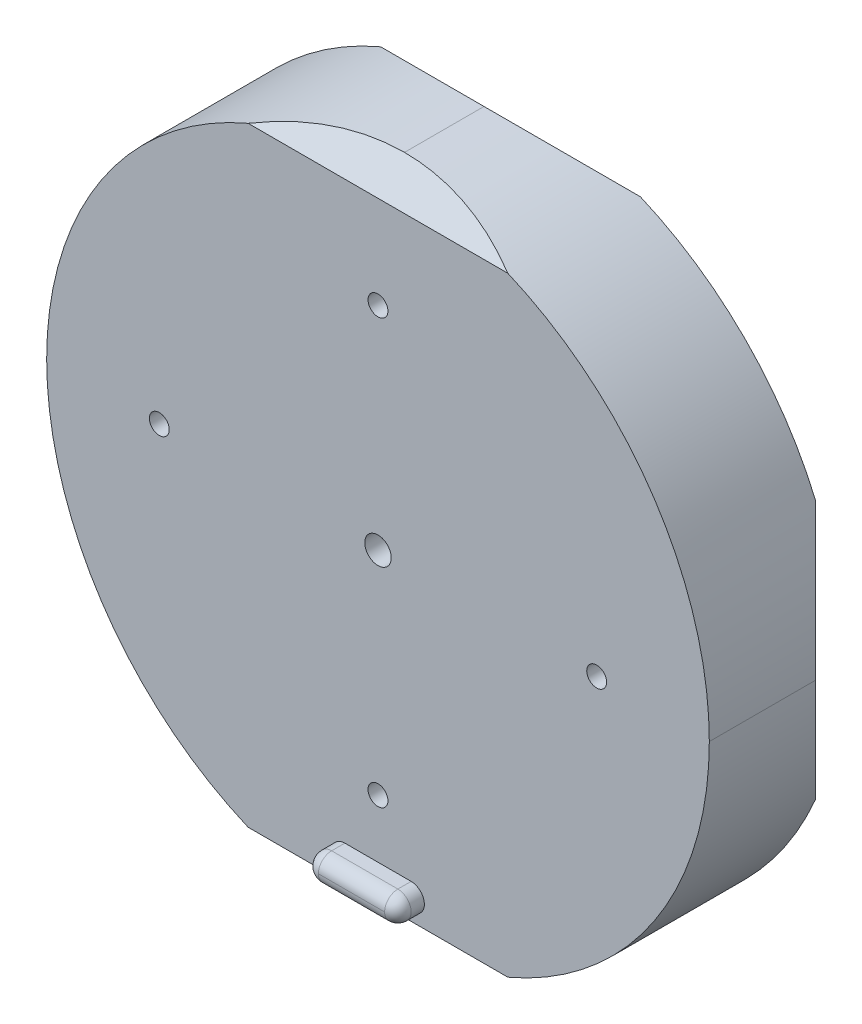
from build123d import *

# Parameters (mm, degrees)
SKETCH10_W          = 50
SKETCH10_H          = 50
BOSS_EXTRUDE7_DEPTH = 5
SKETCH9_W           = 50
SKETCH9_H           = 50
BOSS_EXTRUDE8_DEPTH = 5
SKETCH11_R          = 0.75
CUT_EXTRUDE5_DEPTH  = 5
CHAMFER1_SIZE       = 2
SKETCH12_R          = 1
CUT_EXTRUDE6_DEPTH  = 10
SKETCH14_R          = 0.75
CUT_EXTRUDE8_DEPTH  = 5
BOSS_EXTRUDE9_DEPTH = 2
FILLET1_R           = 1
FILLET2_R           = 25


# Some blends are built 0.0001 mm under size
with BuildPart() as part:
    # Sketch10 → Boss-Extrude7 (new body)
    with BuildSketch(Plane(origin=(0, 0, 0), x_dir=(-1, 0, 0), z_dir=(0, 0, -1))):
        with Locations((-42.5, 20.5)):
            Rectangle(SKETCH10_W, SKETCH10_H)
    extrude(amount=-BOSS_EXTRUDE7_DEPTH)

    # Sketch9 → Boss-Extrude8 (add)
    with BuildSketch(Plane(origin=(0, 0, 0), x_dir=(-1, 0, 0), z_dir=(0, 0, -1))):
        with Locations((-42.5, 20.5)):
            Rectangle(SKETCH9_W, SKETCH9_H)
        with BuildLine():
            Line((-59.2, 24.3), (-48.011787453, 24.5))
            ThreePointArc((-48.011787453, 24.5), (-46.919880362, 24.919880362), (-46.5, 26.011787453))
            Line((-46.5, 26.011787453), (-46.3, 37.2))
            ThreePointArc((-46.3, 37.2), (-42.5, 41), (-38.7, 37.2))
            Line((-38.7, 37.2), (-38.5, 26.011787453))
            ThreePointArc((-38.5, 26.011787453), (-38.080119638, 24.919880362), (-36.988212547, 24.5))
            Line((-36.988212547, 24.5), (-25.8, 24.3))
            ThreePointArc((-25.8, 24.3), (-22, 20.5), (-25.8, 16.7))
            Line((-25.8, 16.7), (-36.988212547, 16.5))
            ThreePointArc((-36.988212547, 16.5), (-38.080119638, 16.080119638), (-38.5, 14.988212547))
            Line((-38.5, 14.988212547), (-38.7, 3.8))
            ThreePointArc((-38.7, 3.8), (-42.5, 0), (-46.3, 3.8))
            Line((-46.3, 3.8), (-46.5, 14.988212547))
            ThreePointArc((-46.5, 14.988212547), (-46.919880362, 16.080119638), (-48.011787453, 16.5))
            Line((-48.011787453, 16.5), (-59.2, 16.7))
            ThreePointArc((-59.2, 16.7), (-63, 20.5), (-59.2, 24.3))
        make_face(mode=Mode.SUBTRACT)
    extrude(amount=BOSS_EXTRUDE8_DEPTH)

    # Sketch11 → Cut-Extrude5 (cut)
    with BuildSketch(Plane(origin=(0, 0, 0), x_dir=(-1, 0, 0), z_dir=(0, 0, -1))):
        with Locations((-59, 20.5)):
            Circle(SKETCH11_R)
        with Locations(Location((-26, 20.5, 0), (0, 0, 180))):
            Circle(SKETCH11_R)
    extrude(amount=-CUT_EXTRUDE5_DEPTH, mode=Mode.SUBTRACT)

    # Chamfer1
    chamfer1_edges = [part.edges().sort_by_distance(p)[0] for p in [
        (42.5, 45.5, 5),
        (67.5, 20.5, -5),
        (42.5, -4.5, -5),
        (17.5, 20.5, -5),
        (42.5, 45.5, -5),
        (42.5, -4.5, 5),
    ]]
    chamfer(chamfer1_edges, length=CHAMFER1_SIZE)

    # Sketch12 → Cut-Extrude6 (cut)
    with BuildSketch(Plane.XY.offset(5)):
        with Locations((42.5, 20.5)):
            Circle(SKETCH12_R)
    extrude(amount=-CUT_EXTRUDE6_DEPTH, mode=Mode.SUBTRACT)

    # Sketch14 → Cut-Extrude8 (cut)
    with BuildSketch(Plane.XY.offset(5)):
        with Locations((42.5, 36.5)):
            Circle(SKETCH14_R)
        with Locations((42.5, 4.5)):
            Circle(SKETCH14_R)
    extrude(amount=-CUT_EXTRUDE8_DEPTH, mode=Mode.SUBTRACT)

    # Sketch15 → Boss-Extrude9 (add)
    with BuildSketch(Plane.XY.offset(5)):
        with BuildLine():
            Line((40, 0.112312602), (45, 0.112312602))
            ThreePointArc((45, 0.112312602), (46, -0.887687398), (45, -1.887687398))
            Line((45, -1.887687398), (40, -1.887687398))
            ThreePointArc((40, -1.887687398), (39, -0.887687398), (40, 0.112312602))
        make_face()
    extrude(amount=BOSS_EXTRUDE9_DEPTH)

    # Fillet1
    fillet1_edges = [part.edges().sort_by_distance(p)[0] for p in [
        (39, -0.887687398, 7),
        (42.5, -1.887687398, 7),
        (46, -0.887687398, 7),
        (42.5, 0.112312602, 7),
    ]]
    fillet(fillet1_edges, radius=FILLET1_R - 0.0001)  # a hair under: the kernel refuses the full size

    # Fillet2
    # the kernel refuses this fillet: 25 mm, written as the material it takes off along each edge
    with BuildSketch(Plane(origin=(17.5, 45.5, -65.5), x_dir=(0, -1, 0), z_dir=(0, 0, 1)), Plane(origin=(67.5, 45.5, 65.5), x_dir=(0, -1, 0), z_dir=(0, 0, -1))) as fillet2_piece_1:
        with BuildLine():
            CenterArc((FILLET2_R, FILLET2_R), FILLET2_R, 180, 90)
            Line((0, FILLET2_R), (0, 0))
            Line((0, 0), (FILLET2_R, 0))
        make_face()
    extrude(amount=131, mode=Mode.SUBTRACT)
    with BuildSketch(Plane(origin=(67.5, -4.5, 65.5), x_dir=(0, 1, 0), z_dir=(0, 0, -1)), Plane(origin=(17.5, -4.5, -65.5), x_dir=(0, 1, 0), z_dir=(0, 0, 1))) as fillet2_piece_2:
        with BuildLine():
            CenterArc((FILLET2_R, -FILLET2_R), FILLET2_R, 90, 90)
            Line((0, -FILLET2_R), (0, 0))
            Line((0, 0), (FILLET2_R, 0))
        make_face()
    extrude(amount=131, mode=Mode.SUBTRACT)


solid = part.part
